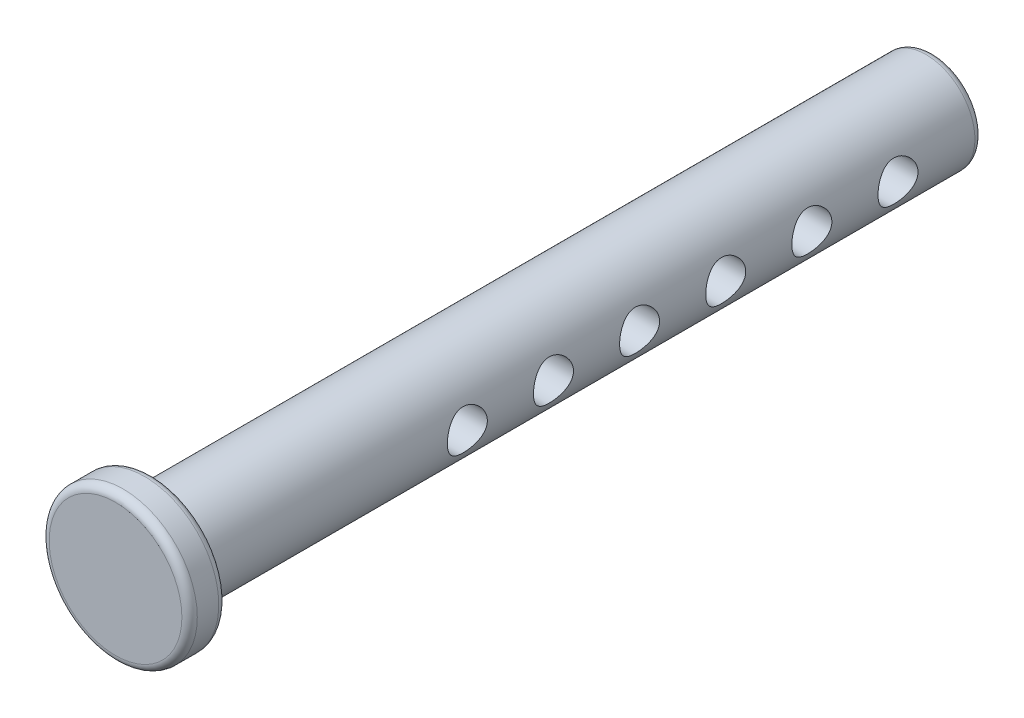
from build123d import *

# Parameters (mm, degrees)
CUT_EXTRUDE1_DEPTH      = 54.63402325
CUT_EXTRUDE1_DEPTH_BACK = 54.63402325
SKETCH2_R               = 1.3
F7F_R                   = 0.5
FILLET2_R               = 0.5


with BuildPart() as part:
    # Sketch1 → Revolve1 (revolve)
    with BuildSketch(Plane.YZ):
        Polygon((0, 0), (4.815, 0), (4.815, -2.4), (3.175, -2.4), (3.175, -53.2), (0, -53.2), align=None)
    revolve(axis=Axis((0, 0, -335.576810525), (0, 0, 1)))

    # Sketch2 → Cut-Extrude1 (cut, two sides: drawn at the far end of the back side and taken through both)
    with BuildSketch(Plane.YZ.offset(-CUT_EXTRUDE1_DEPTH_BACK)):
        with Locations((0, -47.7)):
            Circle(SKETCH2_R)
        with Locations((0, -42.1)):
            Circle(SKETCH2_R)
        with Locations((0, -25.3)):
            Circle(SKETCH2_R)
        with Locations((0, -30.9)):
            Circle(SKETCH2_R)
        with Locations((0, -36.5)):
            Circle(SKETCH2_R)
        with Locations((0, -19.7)):
            Circle(SKETCH2_R)
    extrude(amount=CUT_EXTRUDE1_DEPTH + CUT_EXTRUDE1_DEPTH_BACK, mode=Mode.SUBTRACT)

    # f7f
    f7f_edges = [part.edges().sort_by_distance(p)[0] for p in [
        (0, -4.815, -2.4),
        (0, -4.815, 0),
    ]]
    fillet(f7f_edges, radius=F7F_R)

    # Fillet2
    fillet2_edges = [part.edges().sort_by_distance(p)[0] for p in [
        (0, -3.175, -53.2),
    ]]
    fillet(fillet2_edges, radius=FILLET2_R)


solid = part.part
